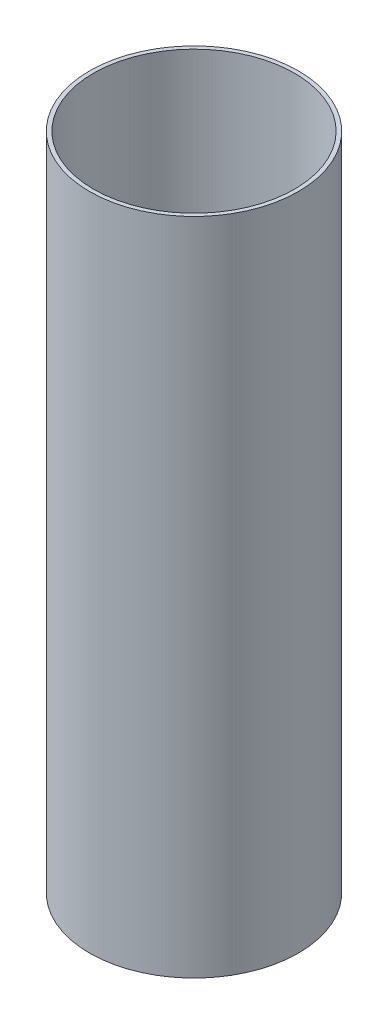
from build123d import *

# Parameters (mm, degrees)
SKETCH1_R           = 39.6
SKETCH1_R_2         = 38.1
BOSS_EXTRUDE1_DEPTH = 250


with BuildPart() as part:
    # Sketch1 → Boss-Extrude1 (new body)
    with BuildSketch(Plane(origin=(0, 0, 0), x_dir=(1, 0, 0), z_dir=(0, 1, 0))):
        Circle(SKETCH1_R)
        Circle(SKETCH1_R_2, mode=Mode.SUBTRACT)
    extrude(amount=BOSS_EXTRUDE1_DEPTH)


solid = part.part
